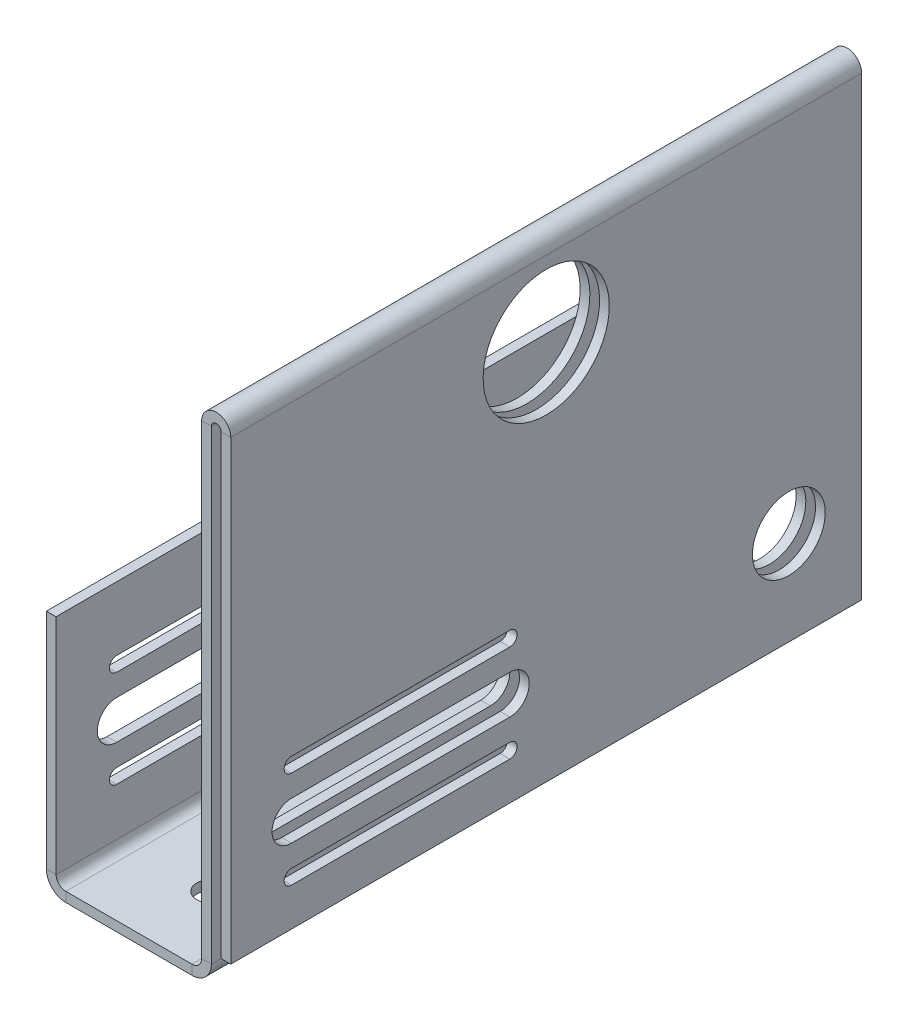
from build123d import *

# Parameters (mm, degrees)
BASE_FLANGE1_DEPTH      = 130
SKETCH6_R               = 3
CUT_EXTRUDE1_DEPTH      = 10
HEM1_DEPTH              = 130
CUT_EXTRUDE2_DEPTH      = 169.205231785
CUT_EXTRUDE2_DEPTH_BACK = 169.205231785
SKETCH7_R               = 13
SKETCH7_R_2             = 7.5
EDGE_FLANGE1_DEPTH      = 130
CUT_EXTRUDE3_DEPTH      = 47


# Read off the part's stored shape, not the designer's step: Hem1
# Sheet-metal steps are written as plain solids
with BuildPart() as part:
    # Sketch1 → Base-Flange1 (new body)
    with BuildSketch(Plane.XY):
        with BuildLine():
            Line((0, 100), (0, 4))
            ThreePointArc((0, 4), (-1.171572875, 1.171572875), (-4, 0))
            Line((-4, 0), (-30, 0))
            Line((-30, 0), (-30, 2))
            Line((-30, 2), (-4, 2))
            ThreePointArc((-4, 2), (-2.585786438, 2.585786438), (-2, 4))
            Line((-2, 4), (-2, 100))
            Line((-2, 100), (0, 100))
        make_face()
    extrude(amount=BASE_FLANGE1_DEPTH)

    # Sketch6 → Cut-Extrude1 (cut)
    with BuildSketch(Plane(origin=(0, 2, 0), x_dir=(1, 0, 0), z_dir=(0, 1, 0))):
        with Locations(Location((-15, -15, 0), (0, 0, 270))):
            Circle(SKETCH6_R)
        with Locations(Location((-15, -115, 0), (0, 0, 270))):
            Circle(SKETCH6_R)
    extrude(amount=-CUT_EXTRUDE1_DEPTH, mode=Mode.SUBTRACT)

    # Hem1 outline → Hem1 (add)
    with BuildSketch(Plane.XY):
        with BuildLine():
            Line((2, 6), (4, 6))
            Line((4, 6), (4, 100))
            ThreePointArc((4, 100), (1, 103), (-2, 100))
            Line((-2, 100), (0, 100))
            ThreePointArc((0, 100), (1, 101), (2, 100))
            Line((2, 100), (2, 6))
        make_face()
    extrude(amount=HEM1_DEPTH)

    # Sketch7 → Cut-Extrude2 (cut, two sides: drawn at the far end of the back side and taken through both)
    with BuildSketch(Plane.ZY.offset(2).offset(-CUT_EXTRUDE2_DEPTH_BACK)):
        with Locations(Location((65, 84.5, 0), (0, 0, 270))):
            Circle(SKETCH7_R)
        with Locations(Location((15, 25.347000811, 0), (0, 0, 270))):
            Circle(SKETCH7_R_2)
        with BuildLine():
            Line((72.5, 29.347000811), (117.5, 29.347000811))
            ThreePointArc((117.5, 29.347000811), (121.5, 25.347000811), (117.5, 21.347000811))
            Line((117.5, 21.347000811), (72.5, 21.347000811))
            ThreePointArc((72.5, 21.347000811), (68.5, 25.347000811), (72.5, 29.347000811))
        make_face()
        with BuildLine():
            Line((72.5, 36.847000811), (117.5, 36.847000811))
            ThreePointArc((117.5, 36.847000811), (119, 35.347000811), (117.5, 33.847000811))
            Line((117.5, 33.847000811), (72.5, 33.847000811))
            ThreePointArc((72.5, 33.847000811), (71, 35.347000811), (72.5, 36.847000811))
        make_face()
        with BuildLine():
            Line((72.5, 13.847000811), (117.5, 13.847000811))
            ThreePointArc((117.5, 13.847000811), (119, 15.347000811), (117.5, 16.847000811))
            Line((117.5, 16.847000811), (72.5, 16.847000811))
            ThreePointArc((72.5, 16.847000811), (71, 15.347000811), (72.5, 13.847000811))
        make_face()
    extrude(amount=CUT_EXTRUDE2_DEPTH + CUT_EXTRUDE2_DEPTH_BACK, mode=Mode.SUBTRACT)

    # Edge-Flange1 section (across the edge) → Edge-Flange1 (add)
    with BuildSketch(Plane(origin=(-32, 2, 0), x_dir=(1, 0, 0), z_dir=(0, 0, 1))):
        with BuildLine():
            Line((-2, 2), (-2, 48))
            Line((-2, 48), (0, 48))
            Line((0, 48), (0, 2))
            ThreePointArc((0, 2), (0.585786438, 0.585786438), (2, 0))
            Line((2, 0), (2, -2))
            ThreePointArc((2, -2), (-0.828427125, -0.828427125), (-2, 2))
        make_face()
    extrude(amount=EDGE_FLANGE1_DEPTH)

    # Sketch7<2> → Cut-Extrude3 (cut)
    with BuildSketch(Plane.ZY.offset(2)):
        with BuildLine():
            Line((72.5, 33.847000811), (117.5, 33.847000811))
            ThreePointArc((117.5, 33.847000811), (119, 35.347000811), (117.5, 36.847000811))
            Line((117.5, 36.847000811), (72.5, 36.847000811))
            ThreePointArc((72.5, 36.847000811), (71, 35.347000811), (72.5, 33.847000811))
        make_face()
        with BuildLine():
            Line((72.5, 21.347000811), (117.5, 21.347000811))
            ThreePointArc((117.5, 21.347000811), (121.5, 25.347000811), (117.5, 29.347000811))
            Line((117.5, 29.347000811), (72.5, 29.347000811))
            ThreePointArc((72.5, 29.347000811), (68.5, 25.347000811), (72.5, 21.347000811))
        make_face()
        with BuildLine():
            ThreePointArc((117.5, 16.847000811), (119, 15.347000811), (117.5, 13.847000811))
            Line((117.5, 13.847000811), (72.5, 13.847000811))
            ThreePointArc((72.5, 13.847000811), (71, 15.347000811), (72.5, 16.847000811))
            Line((72.5, 16.847000811), (117.5, 16.847000811))
        make_face()
    extrude(amount=CUT_EXTRUDE3_DEPTH, mode=Mode.SUBTRACT)


solid = part.part
